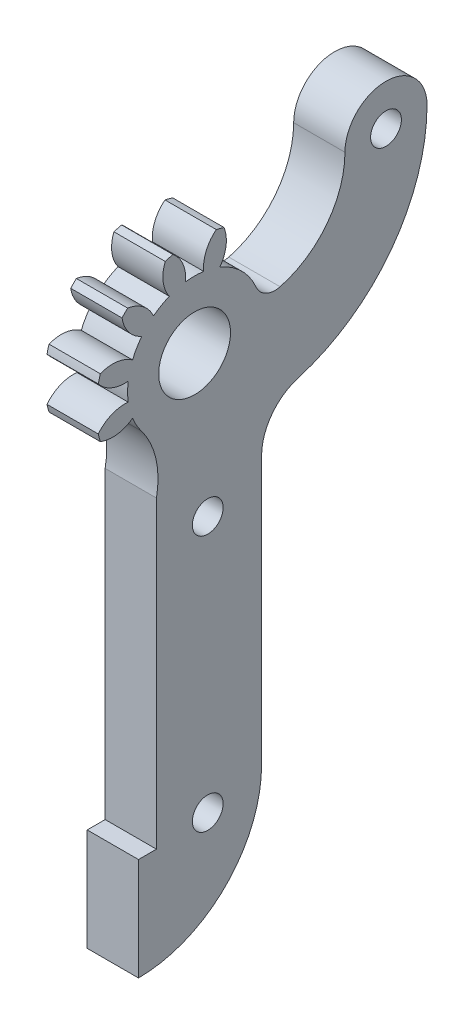
from build123d import *

# Parameters (mm, degrees)
CUT_EXTRUDE2_START     = -5
CUT_EXTRUDE2_OUTLINE_R = 3
CUT_EXTRUDE2_DEPTH     = 5
BOSS_EXTRUDE1_START    = -5
BOSS_EXTRUDE1_DEPTH    = 5
BOSS_EXTRUDE2_START    = -5
SKETCH3_R              = 1.5
BOSS_EXTRUDE2_DEPTH    = 5
FILLET1_R              = 2
FILLET2_R              = 5
SKETCH4_R              = 3.5
CUT_EXTRUDE3_DEPTH     = 10
SKETCH5_R              = 1.5
CUT_EXTRUDE4_DEPTH     = 56.120690806


with BuildPart() as part:
    # Cut-Extrude2: read off the stored shape, not the designer's step
    # Cut-Extrude2 outline → Cut-Extrude2 (new body)
    with BuildSketch(Plane(origin=(5, 0, 0), x_dir=(0, 0, -1), z_dir=(1, 0, 0)).offset(CUT_EXTRUDE2_START)):
        with BuildLine():
            ThreePointArc((-6.52418924, 7.07641009), (-6.805902769, 6.805902769), (-7.07641009, 6.52418924))
            ThreePointArc((-7.07641009, 6.52418924), (-6.439370402, 5.019214625), (-5.158353358, 4.004441996))
            ThreePointArc((-5.158353358, 4.004441996), (-5.655362393, 3.265125), (-6.047125175, 2.465044051))
            ThreePointArc((-6.047125175, 2.465044051), (-7.566452573, 3.06705104), (-9.188318666, 2.866256285))
            ThreePointArc((-9.188318666, 2.866256285), (-9.297036078, 2.491133309), (-9.390445525, 2.111908577))
            ThreePointArc((-9.390445525, 2.111908577), (-8.086265665, 1.127082171), (-6.469486047, 0.888771818))
            ThreePointArc((-6.469486047, 0.888771818), (-6.53025, 0), (-6.469486047, -0.888771818))
            ThreePointArc((-6.469486047, -0.888771818), (-8.086265665, -1.127082171), (-9.390445525, -2.111908577))
            ThreePointArc((-9.390445525, -2.111908577), (-9.297036078, -2.491133309), (-9.188318666, -2.866256285))
            ThreePointArc((-9.188318666, -2.866256285), (-7.566452573, -3.06705104), (-6.047125175, -2.465044051))
            ThreePointArc((-6.047125175, -2.465044051), (4.617584058, -4.617584058), (2.465044051, 6.047125175))
            ThreePointArc((2.465044051, 6.047125175), (3.06705104, 7.566452573), (2.866256285, 9.188318666))
            ThreePointArc((2.866256285, 9.188318666), (2.491133309, 9.297036078), (2.111908577, 9.390445525))
            ThreePointArc((2.111908577, 9.390445525), (1.127082171, 8.086265665), (0.888771818, 6.469486047))
            ThreePointArc((0.888771818, 6.469486047), (0, 6.53025), (-0.888771818, 6.469486047))
            ThreePointArc((-0.888771818, 6.469486047), (-1.127082171, 8.086265665), (-2.111908577, 9.390445525))
            ThreePointArc((-2.111908577, 9.390445525), (-2.491133309, 9.297036078), (-2.866256285, 9.188318666))
            ThreePointArc((-2.866256285, 9.188318666), (-3.06705104, 7.566452573), (-2.465044051, 6.047125175))
            ThreePointArc((-2.465044051, 6.047125175), (-3.265125, 5.655362393), (-4.004441996, 5.158353358))
            ThreePointArc((-4.004441996, 5.158353358), (-5.019214625, 6.439370402), (-6.52418924, 7.07641009))
        make_face()
        Circle(CUT_EXTRUDE2_OUTLINE_R, mode=Mode.SUBTRACT)
    extrude(amount=CUT_EXTRUDE2_DEPTH)

    # Sketch2 → Boss-Extrude1 (add)
    with BuildSketch(Plane(origin=(5, 0, 0), x_dir=(0, 0, -1), z_dir=(1, 0, 0)).offset(BOSS_EXTRUDE1_START)):
        with BuildLine():
            Line((-3.71975, -10.353236172), (-3.71975, -40))
            Line((-3.71975, -40), (-5.46975, -40))
            Line((-5.46975, -40), (-5.46975, -50))
            ThreePointArc((-5.46975, -50), (3.015531374, -46.485281374), (6.53025, -38))
            Line((6.53025, -38), (6.53025, 0))
            ThreePointArc((6.53025, 0), (2.085463632, -6.188295929), (-5.198246307, -3.952518235))
            ThreePointArc((-5.198246307, -3.952518235), (-3.771697436, -6.994118204), (-3.71975, -10.353236172))
        make_face()
    extrude(amount=BOSS_EXTRUDE1_DEPTH)

    # Sketch3 → Boss-Extrude2 (add)
    with BuildSketch(Plane(origin=(5, 0, 0), x_dir=(0, 0, -1), z_dir=(1, 0, 0)).offset(BOSS_EXTRUDE2_START)):
        with BuildLine():
            Line((6.53025, 0), (6.53025, -7.78173689))
            ThreePointArc((6.53025, -7.78173689), (18.005815569, -2.228753726), (22.655916213, 9.64141018))
            ThreePointArc((22.655916213, 9.64141018), (18.655916213, 13.64141018), (14.655916213, 9.64141018))
            ThreePointArc((14.655916213, 9.64141018), (12.257472566, 3.739621168), (6.422011938, 1.184030293))
            ThreePointArc((6.422011938, 1.184030293), (6.503134187, 0.594483644), (6.53025, 0))
        make_face()
        with Locations((18.655916213, 9.64141018)):
            Circle(SKETCH3_R, mode=Mode.SUBTRACT)
    extrude(amount=BOSS_EXTRUDE2_DEPTH)

    # Fillet1
    fillet1_edges = [part.edges().sort_by_distance(p)[0] for p in [
        (2.5, 1.184030293, -6.422011938),
    ]]
    fillet(fillet1_edges, radius=FILLET1_R)

    # Fillet2
    fillet2_edges = [part.edges().sort_by_distance(p)[0] for p in [
        (2.5, -7.78173689, -6.53025),
    ]]
    fillet(fillet2_edges, radius=FILLET2_R)

    # Sketch4 → Cut-Extrude3 (cut)
    with BuildSketch(Plane(origin=(5, 0, 0), x_dir=(0, 0, -1), z_dir=(1, 0, 0))):
        Circle(SKETCH4_R)
    extrude(amount=-CUT_EXTRUDE3_DEPTH, mode=Mode.SUBTRACT)

    # Sketch5 → Cut-Extrude4 (cut, through all)
    with BuildSketch(Plane.ZY):
        with Locations((-1.28025, -14.410797367)):
            Circle(SKETCH5_R)
        with Locations((-1.28025, -39.410797367)):
            Circle(SKETCH5_R)
    extrude(amount=-CUT_EXTRUDE4_DEPTH, mode=Mode.SUBTRACT)


solid = part.part
